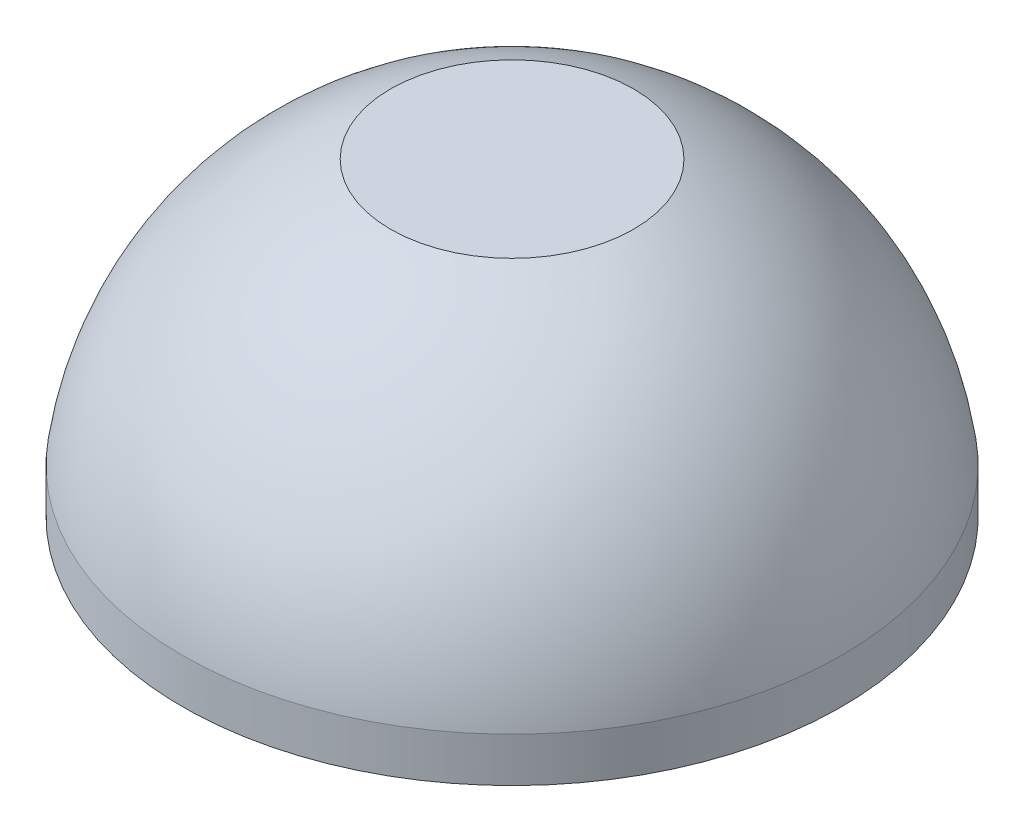
from build123d import *

# Parameters (mm, degrees)
THREAD1_PITCH      = 5.08
SKETCH5_R          = 104.187379233
CUT_EXTRUDE1_DEPTH = 10


with BuildPart() as part:
    # Sketch2 → Revolve2 (revolve)
    with BuildSketch(Plane.XY, mode=Mode.PRIVATE) as revolve2_sk:
        with BuildLine():
            Line((0, 70.113817879), (-27.537107668, 70.113817879))
            ThreePointArc((-27.537107668, 70.113817879), (-59.25833192, 46.504729375), (-74.65, 10.080538488))
            Line((-74.65, 10.080538488), (-74.65, 0))
            Line((-74.65, 0), (-69.65, 0))
            Line((-69.65, 0), (-69.65, 7.080538488))
            Line((-69.65, 7.080538488), (-64.65, 7.080538488))
            Line((-64.65, 7.080538488), (-64.65, 0))
            Line((-64.65, 0), (-61.65, 0))
            Line((-61.65, 0), (-61.65, 6.207005597))
            Line((-61.65, 6.207005597), (-61.65, 10.080538488))
            Line((-61.65, 10.080538488), (-69.65, 10.080538488))
            ThreePointArc((-69.65, 10.080538488), (-51.499351609, 47.964117213), (-15, 68.75856133))
            Line((-15, 68.75856133), (0, 68.75856133))
            Line((0, 68.75856133), (0, 70.113817879))
        make_face()
    revolve(revolve2_sk.sketch.rotate(Axis((0, -4.104684481, 0), (0, 1, 0)), 270), axis=Axis((0, -4.104684481, 0), (0, 1, 0)))

    # Thread1: arcs per turn and ends read off the stored shape
    # Thread1: the profile of Thread Profile1 profile screwed along a right-hand helix through 3.362311 turns, 12 arcs to a turn; built about Z, then put on its axis
    thread1_z = Axis((0, 0, 0), (0, 0, 1))
    thread1_corners = [(64.6497, 0, 0), (64.6497, 0, 3.634587873), (64.65, 0, 3.634587873), (64.904, 0, 3.194646968), (65.92, 0, 2.608059095), (66.174, 0, 2.16811819), (66.174, 0, 1.466469684), (65.92, 0, 1.026528779), (64.904, 0, 0.439940905), (64.65, 0, 0)]
    with BuildLine(mode=Mode.PRIVATE) as thread1_profile:
        Line(thread1_corners[0], thread1_corners[1])
        Line(thread1_corners[3], thread1_corners[4])
        Line(thread1_corners[5], thread1_corners[6])
        Line(thread1_corners[7], thread1_corners[8])
        Line(thread1_corners[9], thread1_corners[0])
        Line(thread1_corners[2], thread1_corners[1])
        ThreePointArc((64.65, 0, 3.634587873), (64.718059095, 0, 3.380587873), (64.904, 0, 3.194646968))
        ThreePointArc((65.92, 0, 2.608059095), (66.105940905, 0, 2.42211819), (66.174, 0, 2.16811819))
        ThreePointArc((66.174, 0, 1.466469684), (66.105940905, 0, 1.212469684), (65.92, 0, 1.026528779))
        ThreePointArc((64.904, 0, 0.439940905), (64.718059095, 0, 0.254), (64.65, 0, 0))
    thread1_cap = Face(thread1_profile.wire())
    thread1_arcs = [((64.65, 0, 3.634587873), (64.65, 0, 3.341293937), (64.904, 0, 3.194646968), (1, 0.866025403784437, 1)), ((65.92, 0, 2.608059095), (66.174, 0, 2.461412127), (66.174, 0, 2.16811819), (1, 0.8660254037844386, 1)), ((66.174, 0, 1.466469684), (66.174, 0, 1.173175747), (65.92, 0, 1.026528779), (1, 0.8660254037844376, 1)), ((64.904, 0, 0.439940905), (64.65, 0, 0.293293937), (64.65, 0, 0), (1, 0.8660254037844369, 1))]  # start, shoulder, end, weights
    thread1_turn_angles = [0, 15, 30, 45, 60, 75, 90, 105, 120, 135, 150, 165, 180, 195, 210, 225, 240, 255, 270, 285, 300, 315, 330, 345, 360]
    thread1_turn_weights = [1, 0.9659258262890683, 1, 0.9659258262890683, 1, 0.9659258262890683, 1, 0.9659258262890683, 1, 0.9659258262890683, 1, 0.9659258262890683, 1, 0.9659258262890683, 1, 0.9659258262890683, 1, 0.9659258262890683, 1, 0.9659258262890683, 1, 0.9659258262890683, 1, 0.9659258262890683, 1]
    thread1_turn_rails = [Edge.make_bspline([Vector(p[0], p[1], 0).rotate(thread1_z, thread1_turn_angles[k]) / thread1_turn_weights[k] + Vector(0, 0, p[2] + THREAD1_PITCH * thread1_turn_angles[k] / 360) for k in range(25)], [0, 0, 0, 1, 1, 2, 2, 3, 3, 4, 4, 5, 5, 6, 6, 7, 7, 8, 8, 9, 9, 10, 10, 11, 11, 12, 12, 12], 2, thread1_turn_weights) for p in thread1_corners]
    thread1_turn_sides = [*[Face.make_surface_from_curves(thread1_turn_rails[p[0]], thread1_turn_rails[p[1]]) for p in [(0, 1), (3, 4), (5, 6), (7, 8), (9, 0), (2, 1)]], *[Face.make_bezier_surface([[Vector(p[j][0], p[j][1], 0).rotate(thread1_z, thread1_turn_angles[2 * i + k]) / thread1_turn_weights[2 * i + k] + Vector(0, 0, p[j][2] + THREAD1_PITCH * thread1_turn_angles[2 * i + k] / 360) for k in range(3)] for j in range(3)], [[p[3][j] * thread1_turn_weights[2 * i + k] for k in range(3)] for j in range(3)]) for p in thread1_arcs for i in range(12)]]
    thread1_last_angles = [1080, 1095, 1110, 1125, 1140, 1155, 1170, 1185, 1200, 1205.216, 1210.432]
    thread1_last_weights = [1, 0.9659258262890683, 1, 0.9659258262890683, 1, 0.9659258262890683, 1, 0.9659258262890683, 1, 0.9958590503947968, 1]
    thread1_last_rails = [Edge.make_bspline([Vector(p[0], p[1], 0).rotate(thread1_z, thread1_last_angles[k]) / thread1_last_weights[k] + Vector(0, 0, p[2] + THREAD1_PITCH * thread1_last_angles[k] / 360) for k in range(11)], [0, 0, 0, 1, 1, 2, 2, 3, 3, 4, 4, 5, 5, 5], 2, thread1_last_weights) for p in thread1_corners]
    thread1_last_sides = [*[Face.make_surface_from_curves(thread1_last_rails[p[0]], thread1_last_rails[p[1]]) for p in [(0, 1), (3, 4), (5, 6), (7, 8), (9, 0), (2, 1)]], *[Face.make_bezier_surface([[Vector(p[j][0], p[j][1], 0).rotate(thread1_z, thread1_last_angles[2 * i + k]) / thread1_last_weights[2 * i + k] + Vector(0, 0, p[j][2] + THREAD1_PITCH * thread1_last_angles[2 * i + k] / 360) for k in range(3)] for j in range(3)], [[p[3][j] * thread1_last_weights[2 * i + k] for k in range(3)] for j in range(3)]) for p in thread1_arcs for i in range(5)]]
    thread1 = Plane(origin=(0, -5, 0), x_dir=(1, 0, 0), z_dir=(0, 1, 0)) * Solid(Shell([*[p.moved(Location((0, 0, THREAD1_PITCH * i))) for i in range(3) for p in thread1_turn_sides], *thread1_last_sides, thread1_cap, thread1_cap.rotate(thread1_z, 1210.432).moved(Location((0, 0, THREAD1_PITCH * 1210.432 / 360)))]))
    add(thread1)

    # Sketch5 → Cut-Extrude1 (cut)
    with BuildSketch(Plane.XZ):
        Circle(SKETCH5_R)
    extrude(amount=CUT_EXTRUDE1_DEPTH, mode=Mode.SUBTRACT)


solid = part.part
